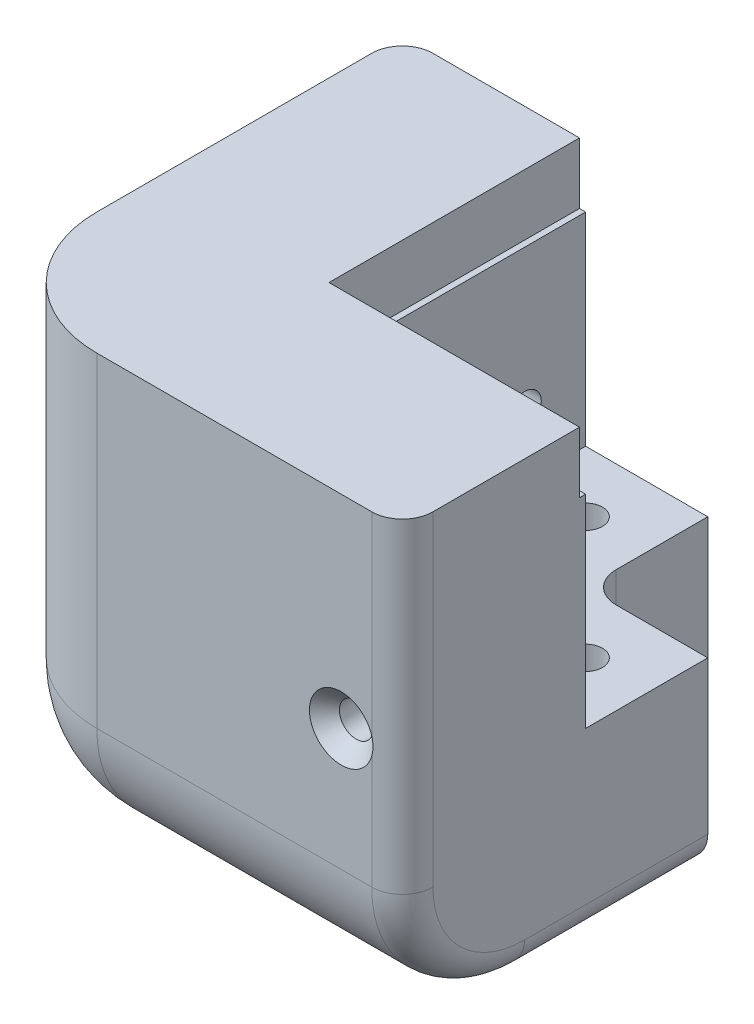
from build123d import *

# Parameters (mm, degrees)
BOSS_EXTRUDE1_DEPTH                             = 30
BOSS_EXTRUDE2_DEPTH                             = 43.2
CSK_FOR_M5_FLAT_HEAD_MACHINE_SCREW1_D           = 5.5
CSK_FOR_M5_FLAT_HEAD_MACHINE_SCREW1_CSINK_D     = 10.4
CSK_FOR_M5_FLAT_HEAD_MACHINE_SCREW1_CSINK_ANGLE = 90
CSK_FOR_M5_FLAT_HEAD_MACHINE_SCREW2_D           = 5.5
CSK_FOR_M5_FLAT_HEAD_MACHINE_SCREW2_CSINK_D     = 10.4
CSK_FOR_M5_FLAT_HEAD_MACHINE_SCREW2_CSINK_ANGLE = 90
CUT_EXTRUDE1_DEPTH                              = 10
FILLET3_R                                       = 20
FILLET4_R                                       = 5


with BuildPart() as part:
    # Sketch1 → Boss-Extrude1 (new body)
    with BuildSketch(Plane(origin=(0, 0, 0), x_dir=(1, 0, 0), z_dir=(0, 1, 0))):
        Polygon((20, 20), (0, 0), (40, 0), (40, 20), align=None)
        Polygon((40, 0), (0, 0), (-30, -30), (40, -30), align=None)
    extrude(amount=-BOSS_EXTRUDE1_DEPTH)

    # Sketch1<3> → Boss-Extrude2 (add)
    with BuildSketch(Plane(origin=(0, 0, 0), x_dir=(1, 0, 0), z_dir=(0, 1, 0))):
        Polygon((40, 0), (0, 0), (-30, -30), (40, -30), align=None)
    extrude(amount=BOSS_EXTRUDE2_DEPTH)

    # CSK for M5 Flat Head Machine Screw1 (through all)
    with Locations(Plane.XY.offset(30)):
        with Locations((30, 10)):
            CounterSinkHole(CSK_FOR_M5_FLAT_HEAD_MACHINE_SCREW1_D / 2, CSK_FOR_M5_FLAT_HEAD_MACHINE_SCREW1_CSINK_D / 2, counter_sink_angle=CSK_FOR_M5_FLAT_HEAD_MACHINE_SCREW1_CSINK_ANGLE)

    # CSK for M5 Flat Head Machine Screw2 (through all)
    with Locations(Plane(origin=(0, -30, 0), x_dir=(-1, 0, 0), z_dir=(0, -1, 0))):
        with Locations((-30, 10)):
            CounterSinkHole(CSK_FOR_M5_FLAT_HEAD_MACHINE_SCREW2_D / 2, CSK_FOR_M5_FLAT_HEAD_MACHINE_SCREW2_CSINK_D / 2, counter_sink_angle=CSK_FOR_M5_FLAT_HEAD_MACHINE_SCREW2_CSINK_ANGLE)

    # Sketch10 → Cut-Extrude1 (cut)
    with BuildSketch(Plane(origin=(0, 43.2, 0), x_dir=(1, 0, 0), z_dir=(0, 1, 0))):
        Polygon((0, 0), (-1, -1), (40, -1), (40, 0), align=None)
    extrude(amount=-CUT_EXTRUDE1_DEPTH, mode=Mode.SUBTRACT)

    # Mirror2: part across plane


with BuildPart() as part_1:
    add(part.part)
    add(part.part.mirror(Plane(origin=(0, -30, 0), x_dir=(-0.7071067811865513, 0, 0.7071067811865438), z_dir=(-0.7071067811865439, 0, -0.7071067811865512))))

    # Fillet3
    fillet3_edges = [part_1.edges().sort_by_distance(p)[0] for p in [
        (5, -30, 30),
        (-30, 6.6, 30),
        (-30, -30, -5),
    ]]
    fillet(fillet3_edges, radius=FILLET3_R)

    # Fillet4
    # the kernel refuses this fillet: 5 mm, written as the material it adds along each edge
    with BuildSketch(Plane(origin=(20, 0, -20), x_dir=(1, 0, 0), z_dir=(0, -1, 0))) as fillet4_piece_1:
        with BuildLine():
            CenterArc((FILLET4_R, -FILLET4_R), FILLET4_R, 90, 90)
            Line((0, -FILLET4_R), (0, 0))
            Line((0, 0), (FILLET4_R, 0))
        make_face()
    extrude(amount=30)
    # the kernel refuses this fillet: 5 mm, written as the material it takes off along each edge
    with BuildSketch(Plane(origin=(40, -10, 30), x_dir=(0, 0, -1), z_dir=(0, 1, 0))) as fillet4_2_piece_1:
        with BuildLine():
            CenterArc((FILLET4_R, FILLET4_R), FILLET4_R, 180, 90)
            Line((0, FILLET4_R), (0, 0))
            Line((0, 0), (FILLET4_R, 0))
        make_face()
    extrude(amount=65.7, mode=Mode.SUBTRACT)
    with BuildSketch(Plane(origin=(40, -30, -32.5), x_dir=(0, 1, 0), z_dir=(0, 0, 1)), Plane(origin=(32.5, -30, -40), x_dir=(0, 0, 1), z_dir=(-1, 0, 0))) as fillet4_2_piece_2:
        with BuildLine():
            CenterArc((FILLET4_R, FILLET4_R), FILLET4_R, 180, 90)
            Line((0, FILLET4_R), (0, 0))
            Line((0, 0), (FILLET4_R, 0))
        make_face()
    extrude(amount=42.5, mode=Mode.SUBTRACT)
    with BuildSketch(Plane(origin=(40, -10, 10), x_dir=(0, -1, 0), z_dir=(0, 0, -1))) as fillet4_2_piece_3:
        with BuildLine():
            CenterArc((20 - FILLET4_R, FILLET4_R), FILLET4_R, 270, 90)
            Line((20, FILLET4_R), (20, 0))
            Line((20, 0), (20 - FILLET4_R, 0))
        make_face()
    revolve(axis=Axis((40, -10, 10), (-1, 0, 0)), revolution_arc=90, mode=Mode.SUBTRACT)
    with BuildSketch(Plane(origin=(-30, -10, -40), x_dir=(1, 0, 0), z_dir=(0, 1, 0))) as fillet4_2_piece_4:
        with BuildLine():
            CenterArc((FILLET4_R, -FILLET4_R), FILLET4_R, 90, 90)
            Line((0, -FILLET4_R), (0, 0))
            Line((0, 0), (FILLET4_R, 0))
        make_face()
    extrude(amount=65.7, mode=Mode.SUBTRACT)
    with BuildSketch(Plane(origin=(-10, -10, -40), x_dir=(0, -1, 0), z_dir=(1, 0, 0))) as fillet4_2_piece_5:
        with BuildLine():
            CenterArc((20 - FILLET4_R, -FILLET4_R), FILLET4_R, 0, 90)
            Line((20 - FILLET4_R, 0), (20, 0))
            Line((20, 0), (20, -FILLET4_R))
        make_face()
    revolve(axis=Axis((-10, -10, -40), (0, 0, -1)), revolution_arc=90, mode=Mode.SUBTRACT)


solid = part_1.part
